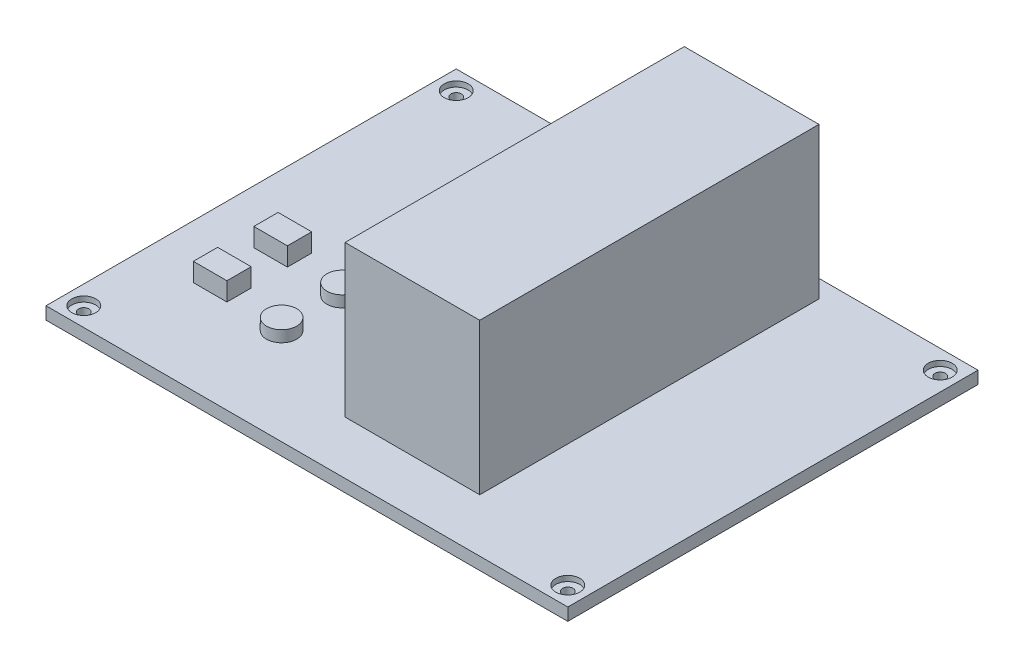
from build123d import *

# Parameters (mm, degrees)
SKETCH1_W                                           = 69.03
SKETCH1_H                                           = 54.27
BOSS_EXTRUDE1_DEPTH                                 = 1.65
SKETCH2_R                                           = 2
BOSS_EXTRUDE2_DEPTH                                 = 1.5
SKETCH3_W                                           = 4.44
SKETCH3_H                                           = 3.21
BOSS_EXTRUDE3_DEPTH                                 = 2.44
SKETCH4_W                                           = 17.82
SKETCH4_H                                           = 44.88
BOSS_EXTRUDE4_DEPTH                                 = 20
CBORE_FOR_00_BINDING_HEAD_MACHINE_SCREW_D           = 1.397
CBORE_FOR_00_BINDING_HEAD_MACHINE_SCREW_CBORE_D     = 3.175
CBORE_FOR_00_BINDING_HEAD_MACHINE_SCREW_CBORE_DEPTH = 0.7112


with BuildPart() as part:
    # Sketch1 → Boss-Extrude1 (new body)
    with BuildSketch(Plane(origin=(0, 0, 0), x_dir=(1, 0, 0), z_dir=(0, 1, 0))):
        Rectangle(SKETCH1_W, SKETCH1_H)
    extrude(amount=BOSS_EXTRUDE1_DEPTH)

    # Sketch2 → Boss-Extrude2 (add)
    with BuildSketch(Plane(origin=(0, 1.65, 0), x_dir=(1, 0, 0), z_dir=(0, 1, 0))):
        with Locations((-16.095, -14.385)):
            Circle(SKETCH2_R)
        with Locations((-16.095, -6.385)):
            Circle(SKETCH2_R)
    extrude(amount=BOSS_EXTRUDE2_DEPTH)

    # Sketch3 → Boss-Extrude3 (add)
    with BuildSketch(Plane(origin=(0, 1.65, 0), x_dir=(1, 0, 0), z_dir=(0, 1, 0))):
        with Locations((-25.195, -13.135)):
            Rectangle(SKETCH3_W, SKETCH3_H)
        with Locations((-25.195, -5.135)):
            Rectangle(SKETCH3_W, SKETCH3_H)
    extrude(amount=BOSS_EXTRUDE3_DEPTH)

    # Sketch4 → Boss-Extrude4 (add)
    with BuildSketch(Plane(origin=(0, 1.65, 0), x_dir=(1, 0, 0), z_dir=(0, 1, 0))):
        with Locations((6.925, 2.335)):
            Rectangle(SKETCH4_W, SKETCH4_H)
    extrude(amount=BOSS_EXTRUDE4_DEPTH)

    # CBORE for #00 Binding Head Machine Screw1 (through all)
    with Locations(Plane(origin=(18.660321972, 1.65, 81.830440854), x_dir=(0, 0, 1), z_dir=(0, 1, 0))):
        with Locations((-106.465440854, -50.675321972), (-57.195440854, -50.675321972), (-57.195440854, 13.354678028), (-106.465440854, 13.354678028)):
            CounterBoreHole(CBORE_FOR_00_BINDING_HEAD_MACHINE_SCREW_D / 2, CBORE_FOR_00_BINDING_HEAD_MACHINE_SCREW_CBORE_D / 2, CBORE_FOR_00_BINDING_HEAD_MACHINE_SCREW_CBORE_DEPTH)


solid = part.part
